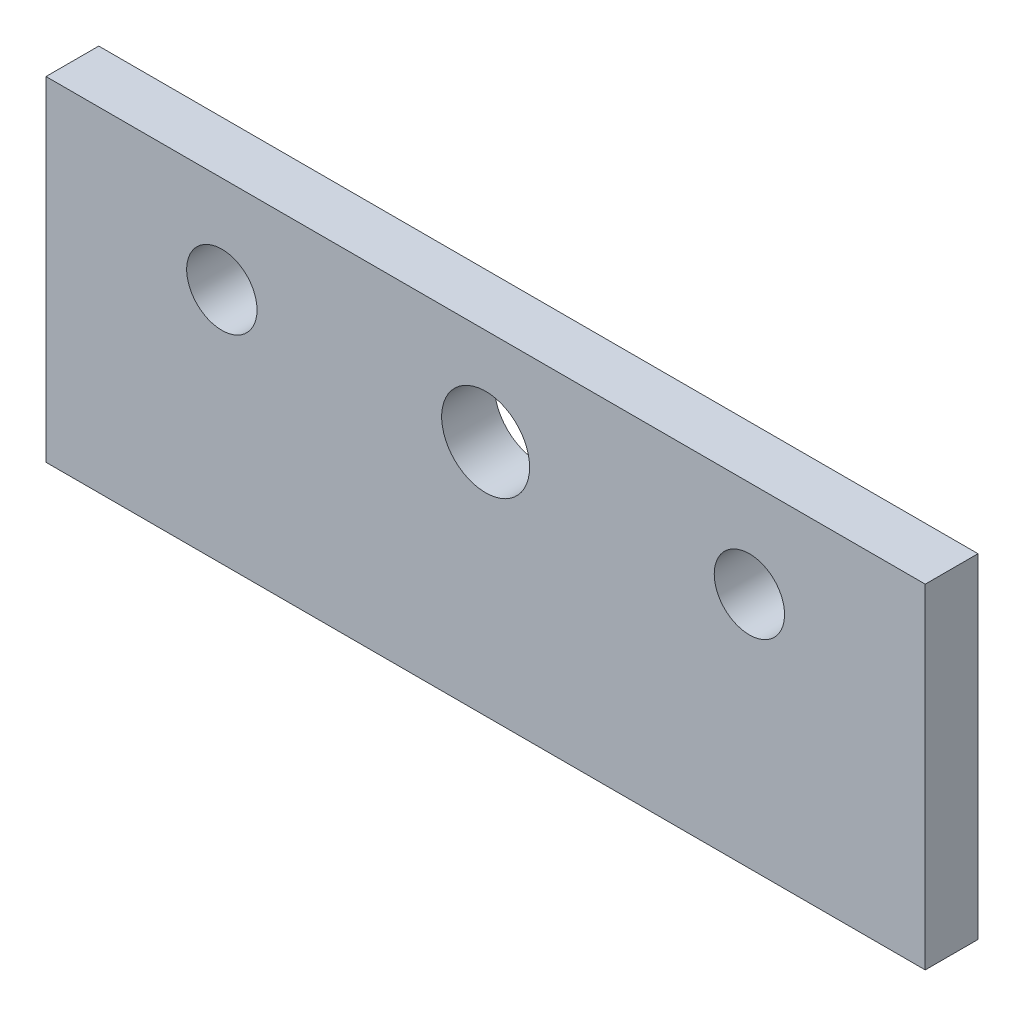
from build123d import *

# Parameters (mm, degrees)
SKETCH_1_W             = 50
SKETCH_1_H             = 19
SKETCH_1_R             = 2
SM_BASE_FLANGE_1_DEPTH = 3
HOLE_WIZARD_M6_1_D     = 5


# Sheet-metal steps are written as plain solids
with BuildPart() as part:
    # Sketch 1 → 基体-法兰1 (new body)
    with BuildSketch(Plane.XY):
        Rectangle(SKETCH_1_W, SKETCH_1_H)
        with Locations((-15, 4)):
            Circle(SKETCH_1_R, mode=Mode.SUBTRACT)
        with Locations(Location((15, 4, 0), (0, 0, 180))):
            Circle(SKETCH_1_R, mode=Mode.SUBTRACT)
    extrude(amount=-SM_BASE_FLANGE_1_DEPTH)

    # M6 螺纹孔1 (through all)
    with Locations(Plane.XY):
        with Locations((0, 4)):
            Hole(HOLE_WIZARD_M6_1_D / 2)


solid = part.part
